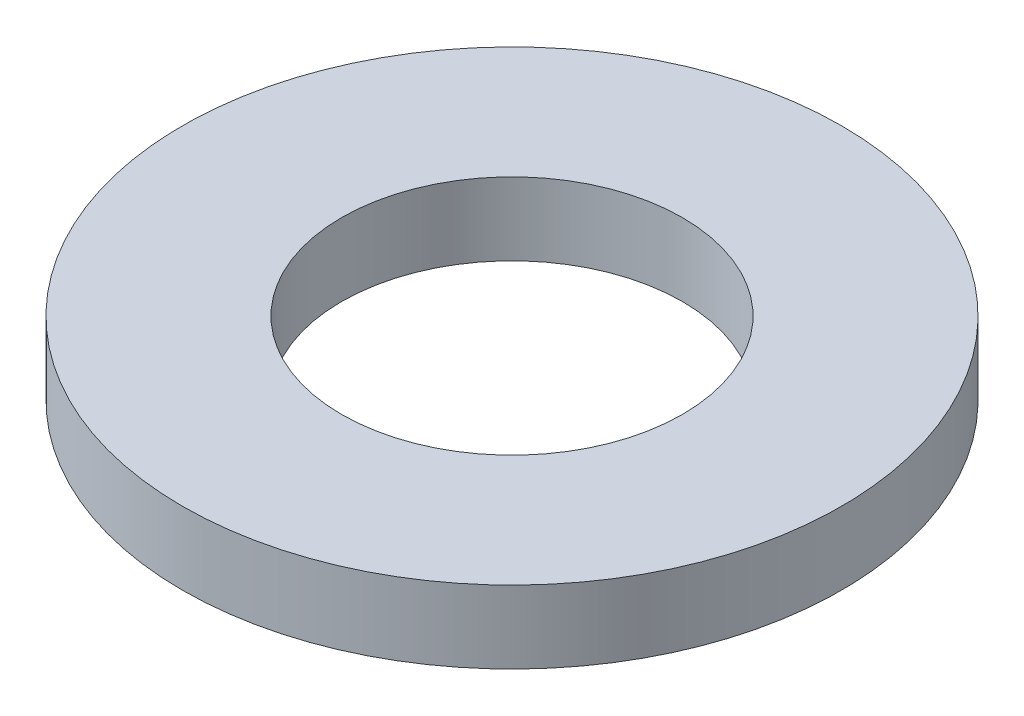
from build123d import *

# Parameters (mm, degrees)
SKETCH1_R           = 72.5
BOSS_EXTRUDE1_DEPTH = 16
SKETCH2_R           = 37.5
CUT_EXTRUDE1_DEPTH  = 104.771383339


with BuildPart() as part:
    # Sketch1 → Boss-Extrude1 (new body)
    with BuildSketch(Plane(origin=(0, 0, 0), x_dir=(1, 0, 0), z_dir=(0, 1, 0))):
        Circle(SKETCH1_R)
    extrude(amount=BOSS_EXTRUDE1_DEPTH)

    # Sketch2 → Cut-Extrude1 (cut, through all)
    with BuildSketch(Plane(origin=(0, 0, 0), x_dir=(1, 0, 0), z_dir=(0, 1, 0))):
        Circle(SKETCH2_R)
    extrude(amount=CUT_EXTRUDE1_DEPTH, mode=Mode.SUBTRACT)


solid = part.part
